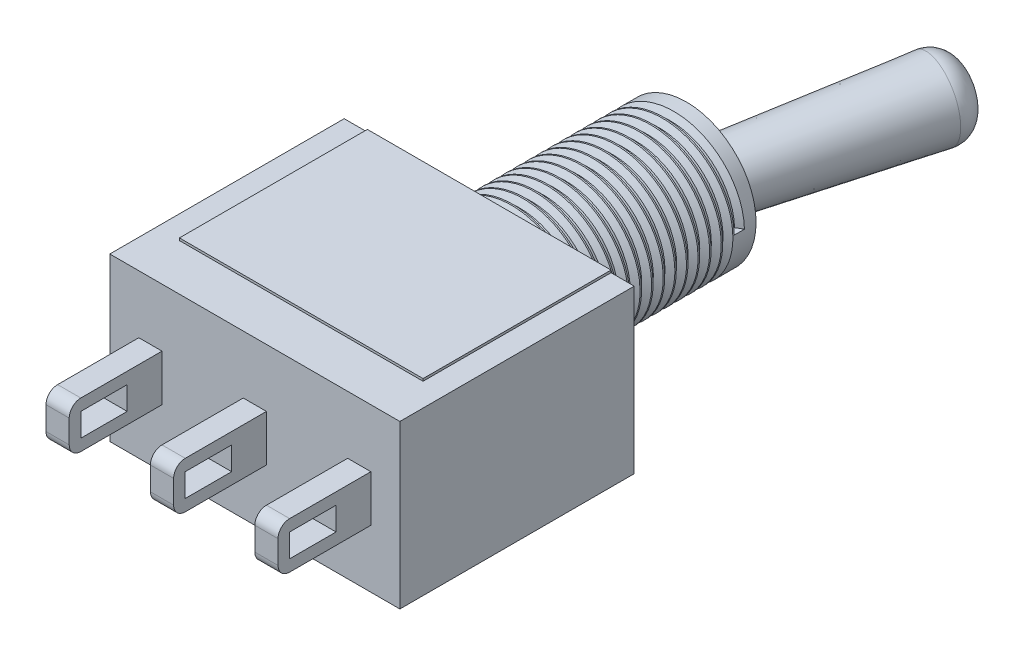
from build123d import *

# Parameters (mm, degrees)
SKETCH1_W            = 12.5
SKETCH1_H            = 7
BOSS_EXTRUDE1_DEPTH  = 10
SKETCH2_W            = 1
SKETCH2_H            = 2
BOSS_EXTRUDE2_DEPTH  = 4
SKETCH3_W            = 2
SKETCH3_H            = 1
CUT_EXTRUDE1_DEPTH   = 19.297882391
SKETCH14_W           = 12.5
SKETCH14_H           = 7
BOSS_EXTRUDE9_DEPTH  = 0.1
SKETCH15_W           = 10.5
SKETCH15_H           = 8.1
BOSS_EXTRUDE10_DEPTH = 0.1
SKETCH16_W           = 10.5
SKETCH16_H           = 8.1
BOSS_EXTRUDE11_DEPTH = 0.1
FILLET1_R            = 0.5
SKETCH4_R            = 3
BOSS_EXTRUDE3_DEPTH  = 8.5
SKETCH5_R            = 2.5
CUT_EXTRUDE2_DEPTH   = 1.5
THREAD1_PITCH        = 0.5
SKETCH10_R           = 1.25
BOSS_EXTRUDE5_DEPTH  = 11
BOSS_EXTRUDE5_DRAFT  = -2
FILLET2_R            = 1


with BuildPart() as part:
    # Sketch1 → Boss-Extrude1 (new body)
    with BuildSketch(Plane.XY):
        Rectangle(SKETCH1_W, SKETCH1_H)
    extrude(amount=BOSS_EXTRUDE1_DEPTH)

    # Sketch2 → Boss-Extrude2 (add)
    with BuildSketch(Plane.XY.offset(10)):
        with Locations((-4.5, 0)):
            Rectangle(SKETCH2_W, SKETCH2_H)
        Rectangle(SKETCH2_W, SKETCH2_H)
        with Locations((4.5, 0)):
            Rectangle(SKETCH2_W, SKETCH2_H)
    extrude(amount=BOSS_EXTRUDE2_DEPTH)

    # Sketch3 → Cut-Extrude1 (cut, through all)
    with BuildSketch(Plane.ZY.offset(5)):
        with Locations((12.5, 0)):
            Rectangle(SKETCH3_W, SKETCH3_H)
    extrude(amount=-CUT_EXTRUDE1_DEPTH, mode=Mode.SUBTRACT)

    # Sketch14 → Boss-Extrude9 (add)
    with BuildSketch(Plane(origin=(0, 0, 0), x_dir=(-1, 0, 0), z_dir=(0, 0, -1))):
        Rectangle(SKETCH14_W, SKETCH14_H)
    extrude(amount=BOSS_EXTRUDE9_DEPTH)

    # Sketch15 → Boss-Extrude10 (add)
    with BuildSketch(Plane(origin=(0, 3.5, 0), x_dir=(1, 0, 0), z_dir=(0, 1, 0))):
        with Locations((0, -3.95)):
            Rectangle(SKETCH15_W, SKETCH15_H)
    extrude(amount=BOSS_EXTRUDE10_DEPTH)

    # Sketch16 → Boss-Extrude11 (add)
    with BuildSketch(Plane(origin=(0, -3.5, 0), x_dir=(-1, 0, 0), z_dir=(0, -1, 0))):
        with Locations((0, -3.95)):
            Rectangle(SKETCH16_W, SKETCH16_H)
    extrude(amount=BOSS_EXTRUDE11_DEPTH)

    # Fillet1
    fillet1_edges = [part.edges().sort_by_distance(p)[0] for p in [
        (-4.5, 1, 14),
        (-4.5, -1, 14),
        (0, 1, 14),
        (0, -1, 14),
        (4.5, 1, 14),
        (4.5, -1, 14),
    ]]
    fillet(fillet1_edges, radius=FILLET1_R)

    # Sketch4 → Boss-Extrude3 (add)
    with BuildSketch(Plane(origin=(0, 0, -0.1), x_dir=(-1, 0, 0), z_dir=(0, 0, -1))):
        with Locations(Location((0, 0, 0), (0, 0, 180))):
            Circle(SKETCH4_R)
    extrude(amount=BOSS_EXTRUDE3_DEPTH)

    # Sketch5 → Cut-Extrude2 (cut)
    with BuildSketch(Plane(origin=(0, 0, -8.6), x_dir=(-1, 0, 0), z_dir=(0, 0, -1))):
        Circle(SKETCH5_R)
    extrude(amount=-CUT_EXTRUDE2_DEPTH, mode=Mode.SUBTRACT)

    # Thread1: the profile of Thread Profile1 profile screwed along a right-hand helix of 20 turns, 6 arcs to a turn; built about Z, then put on its axis
    thread1_z = Axis((0, 0, 0), (0, 0, 1))
    thread1_corners = [(3.0003, 0, -0.000173205), (3.0003, 0, 0.437673204), (2.729367063, 0, 0.281249999), (2.729367063, 0, 0.156249999)]
    with BuildLine(mode=Mode.PRIVATE) as thread1_profile:
        Line(thread1_corners[0], thread1_corners[1])
        Line(thread1_corners[1], thread1_corners[2])
        Line(thread1_corners[2], thread1_corners[3])
        Line(thread1_corners[3], thread1_corners[0])
    thread1_cap = Face(thread1_profile.wire())
    thread1_turn_angles = [0, 30, 60, 90, 120, 150, 180, 210, 240, 270, 300, 330, 360]
    thread1_turn_weights = [1, 0.8660254037844387, 1, 0.8660254037844387, 1, 0.8660254037844387, 1, 0.8660254037844387, 1, 0.8660254037844387, 1, 0.8660254037844387, 1]
    thread1_turn_rails = [Edge.make_bspline([Vector(p[0], p[1], 0).rotate(thread1_z, thread1_turn_angles[k]) / thread1_turn_weights[k] + Vector(0, 0, p[2] + THREAD1_PITCH * thread1_turn_angles[k] / 360) for k in range(13)], [0, 0, 0, 1, 1, 2, 2, 3, 3, 4, 4, 5, 5, 6, 6, 6], 2, thread1_turn_weights) for p in thread1_corners]
    thread1_turn_sides = [Face.make_surface_from_curves(thread1_turn_rails[p[0]], thread1_turn_rails[p[1]]) for p in [(0, 1), (1, 2), (2, 3), (3, 0)]]
    thread1 = Plane(origin=(0, 0, -8.1), x_dir=(1, 0, 0), z_dir=(0, 0, 1)) * Solid(Shell([*[p.moved(Location((0, 0, THREAD1_PITCH * i))) for i in range(20) for p in thread1_turn_sides], thread1_cap, thread1_cap.rotate(thread1_z, 7200).moved(Location((0, 0, THREAD1_PITCH * 7200 / 360)))]))
    add(thread1, mode=Mode.SUBTRACT)


with BuildPart() as boss_extrude5_tool:
    # Sketch10 → Boss-Extrude5 (with draft: the straight prism first)
    with BuildSketch(Plane(origin=(1.760096602, 0.229532028, -6.624390183), x_dir=(0.12931381840409764, -0.9916037194210963, 0), z_dir=(0.25664592778067663, 0.0334688789979094, -0.9659258262890682))):
        with Locations((0, 1.83761522)):
            Circle(SKETCH10_R)
    extrude(amount=BOSS_EXTRUDE5_DEPTH)
    # Boss-Extrude5: the draft: its side faces are tilted about the plane it starts from
    boss_extrude5_sides = [boss_extrude5_tool.faces().sort_by_distance(p)[0] for p in [
        (1.24991033, 1.423583484, -12.412592045),
    ]]
    draft(boss_extrude5_sides, Plane(origin=(1.760096602, 0.229532028, -6.624390183), x_dir=(0.12931381840409764, -0.9916037194210963, 0), z_dir=(0.25664592778067663, 0.0334688789979094, -0.9659258262890682)), BOSS_EXTRUDE5_DRAFT)


with BuildPart() as part_1:
    add(part.part)

    # Boss-Extrude5: add boss_extrude5_tool
    add(boss_extrude5_tool.part)

    # Fillet2
    fillet2_edges = [part_1.edges().sort_by_distance(p)[0] for p in [
        (2.611789814, 1.988565532, -17.725184089),
    ]]
    fillet(fillet2_edges, radius=FILLET2_R)


solid = part_1.part
